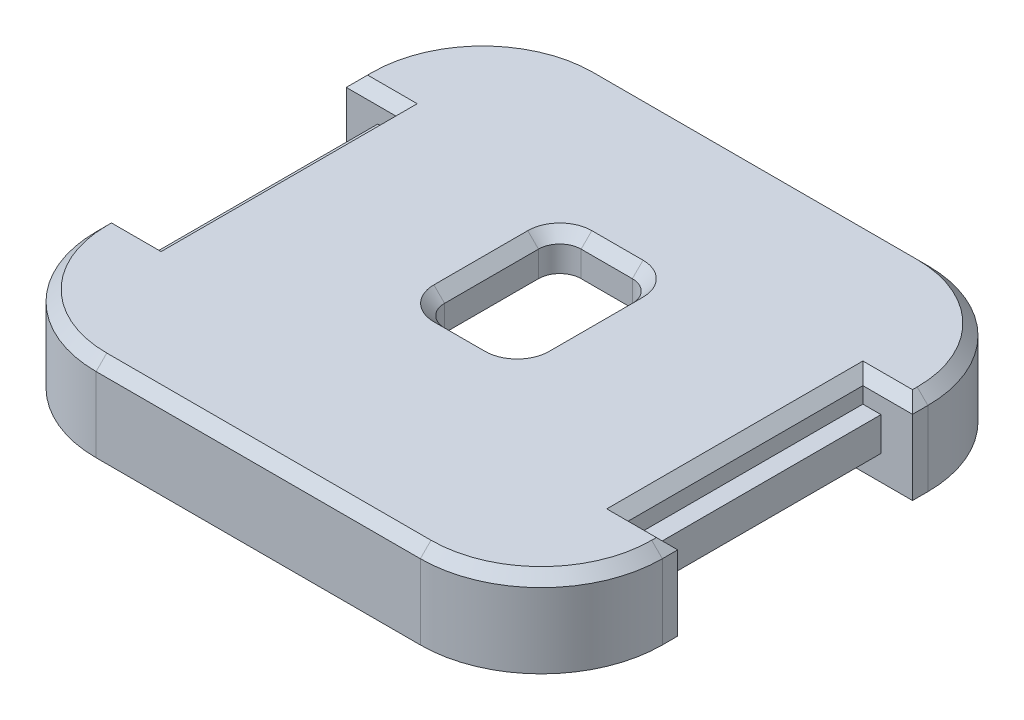
from build123d import *

# Parameters (mm, degrees)
BOSS_EXTRUDE1_DEPTH = 4
CUT_EXTRUDE1_START  = -1.7
CUT_EXTRUDE1_DEPTH  = 18.388140952
CUT_EXTRUDE2_DEPTH  = 20.088140952
SKETCH11_R          = 2.1
CUT_EXTRUDE4_DEPTH  = 20.088140952
CHAMFER1_SIZE       = 1.25
CUT_EXTRUDE5_DEPTH  = 5.5
SKETCH13_R          = 2.1
BOSS_EXTRUDE4_DEPTH = 0.5
CHAMFER3_SIZE       = 0.5


with BuildPart() as part:
    # Sketch1 → Boss-Extrude1 (new body)
    with BuildSketch(Plane(origin=(0, 1.7, 0), x_dir=(1, 0, 0), z_dir=(0, 1, 0))):
        with BuildLine():
            Line((-13.265, 4.98), (-13.265, -7.46))
            ThreePointArc((-13.265, -7.46), (-11.604295449, -11.469295449), (-7.595, -13.13))
            Line((-7.595, -13.13), (7.595, -13.13))
            ThreePointArc((7.595, -13.13), (11.604295449, -11.469295449), (13.265, -7.46))
            Line((13.265, -7.46), (13.265, 4.98))
            ThreePointArc((13.265, 4.98), (11.604295449, 8.989295449), (7.595, 10.65))
            Line((7.595, 10.65), (-7.595, 10.65))
            ThreePointArc((-7.595, 10.65), (-11.604295449, 8.989295449), (-13.265, 4.98))
        make_face()
    extrude(amount=-BOSS_EXTRUDE1_DEPTH)

    # Sketch5 → Cut-Extrude1 (cut, through all)
    with BuildSketch(Plane(origin=(0, 1.7, 0), x_dir=(1, 0, 0), z_dir=(0, 1, 0)).offset(CUT_EXTRUDE1_START)):
        with BuildLine():
            Line((-7.595, -10.48), (7.595, -10.48))
            ThreePointArc((7.595, -10.48), (9.730462479, -9.595462479), (10.615, -7.46))
            Line((10.615, -7.46), (10.615, 4.98))
            ThreePointArc((10.615, 4.98), (9.730462479, 7.115462479), (7.595, 8))
            Line((7.595, 8), (-7.595, 8))
            ThreePointArc((-7.595, 8), (-9.730462479, 7.115462479), (-10.615, 4.98))
            Line((-10.615, 4.98), (-10.615, -7.46))
            ThreePointArc((-10.615, -7.46), (-9.730462479, -9.595462479), (-7.595, -10.48))
        make_face()
    extrude(amount=-CUT_EXTRUDE1_DEPTH, mode=Mode.SUBTRACT)

    # Sketch7 → Cut-Extrude2 (cut, through all)
    with BuildSketch(Plane(origin=(0, 1.7, 0), x_dir=(1, 0, 0), z_dir=(0, 1, 0))):
        with BuildLine():
            Line((2.2, -2.2), (2.2, 2.2))
            ThreePointArc((2.2, 2.2), (1.907106781, 2.907106781), (1.2, 3.2))
            Line((1.2, 3.2), (-1.2, 3.2))
            ThreePointArc((-1.2, 3.2), (-1.907106781, 2.907106781), (-2.2, 2.2))
            Line((-2.2, 2.2), (-2.2, -2.2))
            ThreePointArc((-2.2, -2.2), (-1.907106781, -2.907106781), (-1.2, -3.2))
            Line((-1.2, -3.2), (1.2, -3.2))
            ThreePointArc((1.2, -3.2), (1.907106781, -2.907106781), (2.2, -2.2))
        make_face()
    extrude(amount=-CUT_EXTRUDE2_DEPTH, mode=Mode.SUBTRACT)

    # Sketch11 → Cut-Extrude4 (cut, through all)
    with BuildSketch(Plane(origin=(0, 1.7, 0), x_dir=(1, 0, 0), z_dir=(0, 1, 0))):
        with Locations(Location((-7.615, 5.15, 0), (0, 0, 270))):
            Circle(SKETCH11_R)
        with Locations(Location((7.615, 5.15, 0), (0, 0, 270))):
            Circle(SKETCH11_R)
    extrude(amount=-CUT_EXTRUDE4_DEPTH, mode=Mode.SUBTRACT)

    # Chamfer1
    # the kernel refuses this chamfer: 1.25 mm, written as the material it adds along each edge
    with BuildSketch(Plane(origin=(-7.595, 0, 7.46), x_dir=(-1, 0, 0), z_dir=(0, 0, -1))) as chamfer1_piece_1:
        Polygon((3.02, -CHAMFER1_SIZE), (3.02 - CHAMFER1_SIZE, 0), (3.02, 0), align=None)
    revolve(axis=Axis((-7.595, 0, 7.46), (0, 1, 0)), revolution_arc=90)
    with BuildSketch(Plane(origin=(-7.595, 0, 10.48), x_dir=(0, -0.9996219169112968, 0.027495876610586317), z_dir=(1, 0, 0))) as chamfer1_piece_2:
        Polygon((CHAMFER1_SIZE * 0.999621916911, CHAMFER1_SIZE * 0.0274958766106), (-CHAMFER1_SIZE * 0.0274958766106, CHAMFER1_SIZE * 0.999621916911), (0, 0), align=None)
    extrude(amount=15.19)
    with BuildSketch(Plane(origin=(7.595, 0, 7.46), x_dir=(0, 0, 1), z_dir=(-1, 0, 0))) as chamfer1_piece_3:
        Polygon((3.02, -CHAMFER1_SIZE), (3.02 - CHAMFER1_SIZE, 0), (3.02, 0), align=None)
    revolve(axis=Axis((7.595, 0, 7.46), (0, 1, 0)), revolution_arc=90)
    with BuildSketch(Plane(origin=(10.615, 0, 7.46), x_dir=(0.027495876610586317, -0.9996219169112968, 0), z_dir=(0, 0, -1))) as chamfer1_piece_4_section:
        Polygon((CHAMFER1_SIZE * 0.999621916911, CHAMFER1_SIZE * 0.0274958766106), (-CHAMFER1_SIZE * 0.0274958766106, CHAMFER1_SIZE * 0.999621916911), (0, 0), align=None)
    chamfer1_piece_4 = extrude(amount=12.44, mode=Mode.PRIVATE)
    chamfer1_piece_4 = chamfer1_piece_4 - Plane(origin=(7.615, -0.413583305, -5.15), x_dir=(0, 0, 1), z_dir=(0, 1, 0)) * Cylinder(2.1, 30, mode=Mode.PRIVATE)
    add(chamfer1_piece_4)
    with BuildSketch(Plane(origin=(7.595, 0, -4.98), x_dir=(1, 0, 0), z_dir=(0, 0, 1))) as chamfer1_piece_5_section:
        Polygon((3.02, -CHAMFER1_SIZE), (3.02 - CHAMFER1_SIZE, 0), (3.02, 0), align=None)
    chamfer1_piece_5 = revolve(axis=Axis((7.595, 0, -4.98), (0, 1, 0)), revolution_arc=90, mode=Mode.PRIVATE)
    chamfer1_piece_5 = chamfer1_piece_5 - Plane(origin=(7.615, -0.471032406, -5.15), x_dir=(0, 0, 1), z_dir=(0, 1, 0)) * Cylinder(2.1, 13, mode=Mode.PRIVATE)
    add(chamfer1_piece_5)
    with BuildSketch(Plane(origin=(7.595, 0, -8), x_dir=(0, -0.9996219169112968, -0.027495876610586317), z_dir=(-1, 0, 0))) as chamfer1_piece_6_section:
        Polygon((CHAMFER1_SIZE * 0.999621916911, CHAMFER1_SIZE * 0.0274958766106), (-CHAMFER1_SIZE * 0.0274958766106, CHAMFER1_SIZE * 0.999621916911), (0, 0), align=None)
    chamfer1_piece_6 = extrude(amount=15.19, mode=Mode.PRIVATE)
    chamfer1_piece_6 = chamfer1_piece_6 - Plane(origin=(-7.615, -0.417580446, -5.15), x_dir=(0, 0, 1), z_dir=(0, 1, 0)) * Cylinder(2.1, 36, mode=Mode.PRIVATE)
    chamfer1_piece_6 = chamfer1_piece_6 - Plane(origin=(7.615, -0.417580446, -5.15), x_dir=(0, 0, 1), z_dir=(0, 1, 0)) * Cylinder(2.1, 36, mode=Mode.PRIVATE)
    add(chamfer1_piece_6)
    with BuildSketch(Plane(origin=(-7.595, 0, -4.98), x_dir=(0, 0, -1), z_dir=(1, 0, 0))) as chamfer1_piece_7_section:
        Polygon((3.02, -CHAMFER1_SIZE), (3.02 - CHAMFER1_SIZE, 0), (3.02, 0), align=None)
    chamfer1_piece_7 = revolve(axis=Axis((-7.595, 0, -4.98), (0, 1, 0)), revolution_arc=90, mode=Mode.PRIVATE)
    chamfer1_piece_7 = chamfer1_piece_7 - Plane(origin=(-7.615, -0.471032404, -5.15), x_dir=(0, 0, 1), z_dir=(0, 1, 0)) * Cylinder(2.1, 13, mode=Mode.PRIVATE)
    add(chamfer1_piece_7)
    with BuildSketch(Plane(origin=(-10.615, 0, -4.98), x_dir=(-0.027495876610586317, -0.9996219169112968, 0), z_dir=(0, 0, 1))) as chamfer1_piece_8_section:
        Polygon((CHAMFER1_SIZE * 0.999621916911, CHAMFER1_SIZE * 0.0274958766106), (-CHAMFER1_SIZE * 0.0274958766106, CHAMFER1_SIZE * 0.999621916911), (0, 0), align=None)
    chamfer1_piece_8 = extrude(amount=12.44, mode=Mode.PRIVATE)
    chamfer1_piece_8 = chamfer1_piece_8 - Plane(origin=(-7.615, -0.413583304, -5.15), x_dir=(0, 0, 1), z_dir=(0, 1, 0)) * Cylinder(2.1, 30, mode=Mode.PRIVATE)
    add(chamfer1_piece_8)

    # Sketch12 → Cut-Extrude5 (cut, symmetric)
    with BuildSketch(Plane.XY.offset(1.24)):
        Polygon((11.79, -2.45), (13.415, -2.45), (13.415, 1.85), (10.94, 1.85), (10.94, 0.45), (11.79, 0.45), (11.79, -1.125), (10.615, -2.3), (11.79, -2.3), align=None)
    cut_extrude5 = extrude(amount=CUT_EXTRUDE5_DEPTH, both=True, mode=Mode.SUBTRACT)

    # Mirror1: Cut-Extrude5 across plane
    add(cut_extrude5.mirror(Plane(origin=(0, 0, 0), x_dir=(0, 0, 1), z_dir=(1, 0, 0))), mode=Mode.SUBTRACT)

    # Sketch13 → Boss-Extrude4 (add)
    with BuildSketch(Plane(origin=(0, 1.7, 0), x_dir=(1, 0, 0), z_dir=(0, 1, 0))):
        with Locations(Location((7.615, 5.15, 0), (0, 0, 270))):
            Circle(SKETCH13_R)
        with Locations(Location((-7.615, 5.15, 0), (0, 0, 270))):
            Circle(SKETCH13_R)
    extrude(amount=-BOSS_EXTRUDE4_DEPTH)

    # Chamfer3
    chamfer3_edges = [part.edges().sort_by_distance(p)[0] for p in [
        (-13.265, 1.7, -4.62),
        (-11.604295449, 1.7, -8.989295449),
        (13.265, 1.7, -4.62),
        (10.94, 1.7, 1.24),
        (12.1025, 1.7, 6.74),
        (12.1025, 1.7, -4.26),
        (-13.265, 1.7, 7.1),
        (-10.94, 1.7, 1.24),
        (-12.1025, 1.7, 6.74),
        (-12.1025, 1.7, -4.26),
        (-1.907106781, 1.7, 2.907106781),
        (0, 1.7, 3.2),
        (1.907106781, 1.7, 2.907106781),
        (2.2, 1.7, 0),
        (1.907106781, 1.7, -2.907106781),
        (0, 1.7, -3.2),
        (0, 1.7, -10.65),
        (-1.907106781, 1.7, -2.907106781),
        (-2.2, 1.7, 0),
        (11.604295449, 1.7, -8.989295449),
        (13.265, 1.7, 7.1),
        (11.604295449, 1.7, 11.469295449),
        (0, 1.7, 13.13),
        (-11.604295449, 1.7, 11.469295449),
    ]]
    chamfer(chamfer3_edges, length=CHAMFER3_SIZE)


solid = part.part
